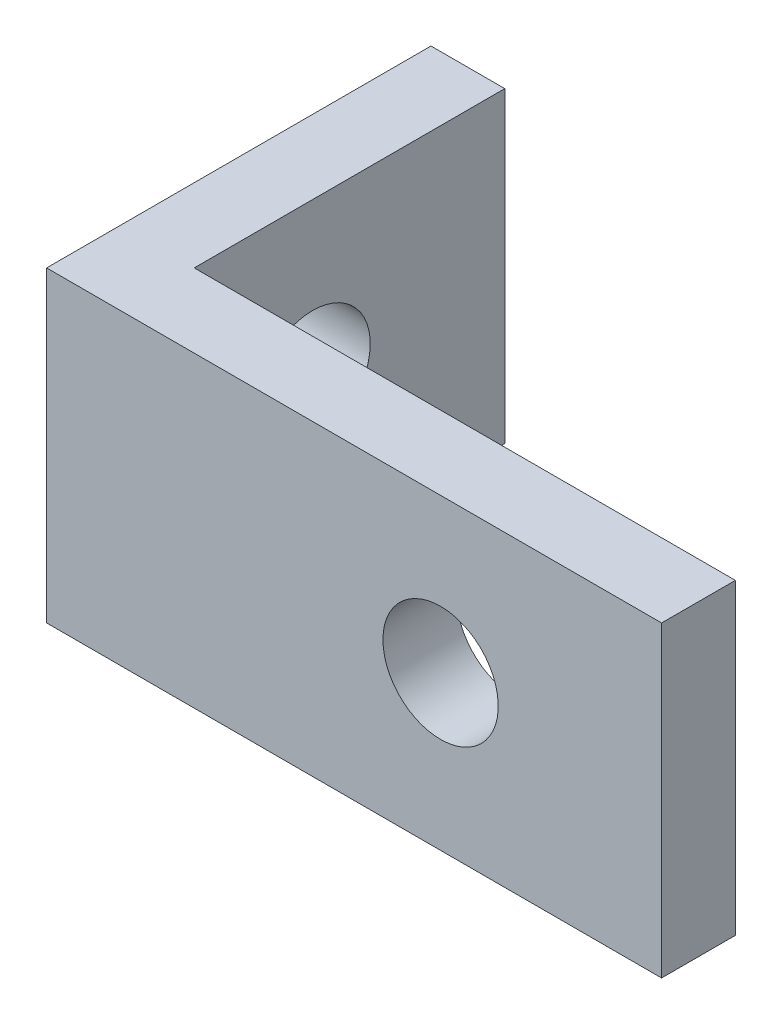
from build123d import *

# Parameters (mm, degrees)
SKETCH1_W           = 25.4
SKETCH1_H           = 12.7
BOSS_EXTRUDE1_DEPTH = 3.048
SKETCH2_W           = 3.048
SKETCH2_H           = 12.7
BOSS_EXTRUDE2_DEPTH = 15.875
SKETCH3_R           = 2.38125
CUT_EXTRUDE1_DEPTH  = 32.160582937
SKETCH4_R           = 2.38125
CUT_EXTRUDE2_DEPTH  = 29.730364303


with BuildPart() as part:
    # Sketch1 → Boss-Extrude1 (new body)
    with BuildSketch(Plane.XY):
        with Locations((12.7, 6.35)):
            Rectangle(SKETCH1_W, SKETCH1_H)
    extrude(amount=BOSS_EXTRUDE1_DEPTH)

    # Sketch2 → Boss-Extrude2 (add)
    with BuildSketch(Plane.XY.offset(3.048)):
        with Locations((1.524, 6.35)):
            Rectangle(SKETCH2_W, SKETCH2_H)
    extrude(amount=-BOSS_EXTRUDE2_DEPTH)

    # Sketch3 → Cut-Extrude1 (cut, through all)
    with BuildSketch(Plane(origin=(0, 0, 0), x_dir=(-1, 0, 0), z_dir=(0, 0, -1))):
        with Locations((-16.271875, 6.35)):
            Circle(SKETCH3_R)
    extrude(amount=-CUT_EXTRUDE1_DEPTH, mode=Mode.SUBTRACT)

    # Sketch4 → Cut-Extrude2 (cut, through all)
    with BuildSketch(Plane(origin=(3.048, 0, 0), x_dir=(0, 0, -1), z_dir=(1, 0, 0))):
        with Locations((4.8895, 6.35)):
            Circle(SKETCH4_R)
    extrude(amount=-CUT_EXTRUDE2_DEPTH, mode=Mode.SUBTRACT)


solid = part.part
